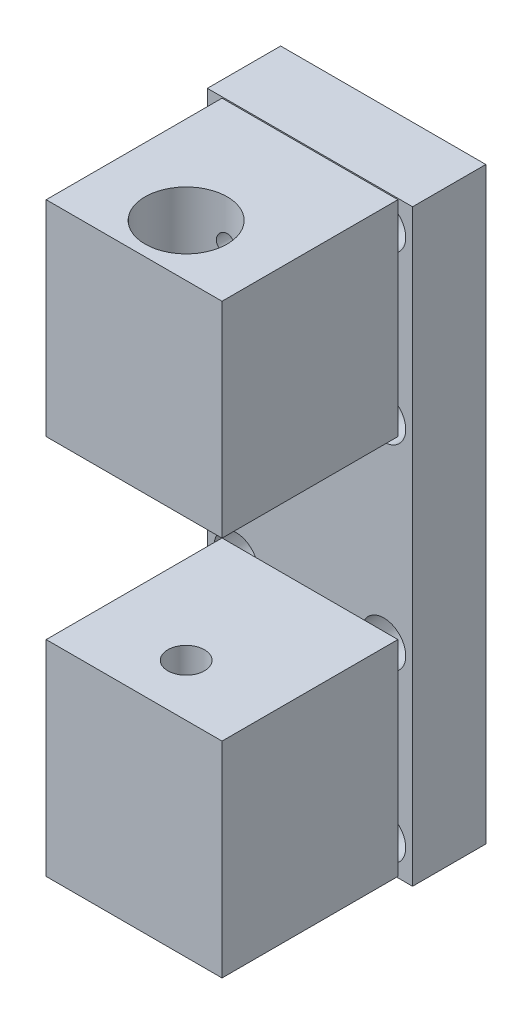
from build123d import *

# Parameters (mm, degrees)
SKETCH1_W               = 44.45
SKETCH1_H               = 127.5
SKETCH1_R               = 2.65
BOSS_EXTRUDE1_DEPTH     = 6.35
BOSS_EXTRUDE2_START     = 6.35
SKETCH1_3_W             = 44.45
SKETCH1_3_H             = 127.5
SKETCH1_3_R             = 4.75
BOSS_EXTRUDE2_DEPTH     = 9.525
SKETCH3_W               = 38.1
SKETCH3_H               = 44.45
BOSS_EXTRUDE3_DEPTH     = 19.05
SKETCH4_R               = 3.96875
CUT_EXTRUDE1_DEPTH      = 218.433121666
CUT_EXTRUDE2_START      = -5.55625
SKETCH4_3_R             = 8.89
CUT_EXTRUDE2_DEPTH      = 212.876871666
CUT_EXTRUDE3_REACH      = 227.903
CUT_EXTRUDE3_END_RADIUS = 8.89
SKETCH5_R               = 2.1
SKETCH5_3_R             = 2.65
SKETCH5_3_R_2           = 2.1
CUT_EXTRUDE4_DEPTH      = 226.903311729
SKETCH5_4_R             = 4.75
SKETCH5_4_R_2           = 2.65
CUT_EXTRUDE5_DEPTH      = 6.35
MIRROR2_OUTLINE_R       = 4.75
MIRROR2_DEPTH           = 6.35
MIRROR2_START           = 6.35
MIRROR2_2_OUTLINE_R     = 2.65
MIRROR2_2_DEPTH         = 9.525


# Read off the part's stored shape, not the designer's step: Mirror2
with BuildPart() as part:
    # Sketch1 → Boss-Extrude1 (new body)
    with BuildSketch(Plane.XY):
        with Locations((-171.45, -39.25)):
            Rectangle(SKETCH1_W, SKETCH1_H)
        with Locations((-155.45, -96.5)):
            Circle(SKETCH1_R, mode=Mode.SUBTRACT)
        with Locations((-187.45, -96.5)):
            Circle(SKETCH1_R, mode=Mode.SUBTRACT)
        with Locations((-187.45, -60.5)):
            Circle(SKETCH1_R, mode=Mode.SUBTRACT)
        with Locations((-155.45, -60.5)):
            Circle(SKETCH1_R, mode=Mode.SUBTRACT)
        with Locations((-155.45, -18)):
            Circle(SKETCH1_R, mode=Mode.SUBTRACT)
        with Locations((-187.45, -18)):
            Circle(SKETCH1_R, mode=Mode.SUBTRACT)
        with Locations((-187.45, 18)):
            Circle(SKETCH1_R, mode=Mode.SUBTRACT)
        with Locations((-155.45, 18)):
            Circle(SKETCH1_R, mode=Mode.SUBTRACT)
    extrude(amount=BOSS_EXTRUDE1_DEPTH)

    # Sketch1<3> → Boss-Extrude2 (add)
    with BuildSketch(Plane.XY.offset(BOSS_EXTRUDE2_START)):
        with Locations((-171.45, -39.25)):
            Rectangle(SKETCH1_3_W, SKETCH1_3_H)
        with Locations(Location((-187.45, -96.5, 0), (0, 0, 180))):
            Circle(SKETCH1_3_R, mode=Mode.SUBTRACT)
        with Locations(Location((-155.45, -96.5, 0), (0, 0, 180))):
            Circle(SKETCH1_3_R, mode=Mode.SUBTRACT)
        with Locations(Location((-187.45, -60.5, 0), (0, 0, 180))):
            Circle(SKETCH1_3_R, mode=Mode.SUBTRACT)
        with Locations(Location((-155.45, -60.5, 0), (0, 0, 180))):
            Circle(SKETCH1_3_R, mode=Mode.SUBTRACT)
        with Locations(Location((-155.45, -18, 0), (0, 0, 180))):
            Circle(SKETCH1_3_R, mode=Mode.SUBTRACT)
        with Locations(Location((-187.45, -18, 0), (0, 0, 180))):
            Circle(SKETCH1_3_R, mode=Mode.SUBTRACT)
        with Locations(Location((-187.45, 18, 0), (0, 0, 180))):
            Circle(SKETCH1_3_R, mode=Mode.SUBTRACT)
        with Locations(Location((-155.45, 18, 0), (0, 0, 180))):
            Circle(SKETCH1_3_R, mode=Mode.SUBTRACT)
    extrude(amount=BOSS_EXTRUDE2_DEPTH)


with BuildPart() as body_2:
    # Sketch3 → Boss-Extrude3 (new, symmetric)
    with BuildSketch(Plane.ZY.offset(171.45)):
        with Locations((34.925, -80.513019347)):
            Rectangle(SKETCH3_W, SKETCH3_H)
    extrude(amount=BOSS_EXTRUDE3_DEPTH, both=True)

    # Sketch4 → Cut-Extrude1 (cut, through all)
    with BuildSketch(Plane(origin=(0, -58.288019347, 0), x_dir=(-1, 0, 0), z_dir=(0, 1, 0))):
        with Locations(Location((171.45, 42.70375, 0), (0, 0, 90))):
            Circle(SKETCH4_R)
    extrude(amount=-CUT_EXTRUDE1_DEPTH, mode=Mode.SUBTRACT)

    # Sketch4<3> → Cut-Extrude2 (cut, through all)
    with BuildSketch(Plane(origin=(0, -58.288019347, 0), x_dir=(-1, 0, 0), z_dir=(0, 1, 0)).offset(CUT_EXTRUDE2_START)):
        with Locations(Location((171.45, 42.70375, 0), (0, 0, 90))):
            Circle(SKETCH4_3_R)
    extrude(amount=-CUT_EXTRUDE2_DEPTH, mode=Mode.SUBTRACT)


with BuildPart() as cut_extrude3_tool:
    # Cut-Extrude3: up to this cylinder (the profile starts outside it)
    cut_extrude3_end = Plane(origin=(-171.45, -80.741619, 42.70375), z_dir=(0, 1, 0)) * Cylinder(CUT_EXTRUDE3_END_RADIUS, 500.5788, mode=Mode.PRIVATE)
    # Sketch5 → Cut-Extrude3 (new, up to the surface)
    with BuildSketch(Plane(origin=(0, 0, 0), x_dir=(1, 0, 0), z_dir=(0, 0, -1)), mode=Mode.PRIVATE) as cut_extrude3_sk1:
        with Locations(Location((-171.45, 67.745219347, 0), (0, 0, 180))):
            Circle(SKETCH5_R)
    cut_extrude3_tool1 = extrude(cut_extrude3_sk1.sketch, amount=-CUT_EXTRUDE3_REACH, mode=Mode.PRIVATE) - cut_extrude3_end
    add(cut_extrude3_tool1.solids().sort_by_distance((-171.45, -67.745219, 0))[0])
    # Sketch5 → Cut-Extrude3 (new, up to the surface)
    with BuildSketch(Plane(origin=(0, 0, 0), x_dir=(1, 0, 0), z_dir=(0, 0, -1)), mode=Mode.PRIVATE) as cut_extrude3_sk2:
        with Locations(Location((-171.45, 93.738019347, 0), (0, 0, 180))):
            Circle(SKETCH5_R)
    cut_extrude3_tool2 = extrude(cut_extrude3_sk2.sketch, amount=-CUT_EXTRUDE3_REACH, mode=Mode.PRIVATE) - cut_extrude3_end
    add(cut_extrude3_tool2.solids().sort_by_distance((-171.45, -93.738019, 0))[0])


with BuildPart() as part_1:
    add(part.part)

    # Cut-Extrude3: cut by cut_extrude3_tool
    add(cut_extrude3_tool.part, mode=Mode.SUBTRACT)

    # Sketch5<3> → Cut-Extrude4 (cut, through all)
    # profile 1 of 2: a face of its own
    with BuildSketch(Plane(origin=(0, 0, 0), x_dir=(1, 0, 0), z_dir=(0, 0, -1))):
        with Locations(Location((-171.45, 67.745219347, 0), (0, 0, 180))):
            Circle(SKETCH5_3_R)
        with Locations(Location((-171.45, 67.745219347, 0), (0, 0, 180))):
            Circle(SKETCH5_3_R_2, mode=Mode.SUBTRACT)
    # profile 2 of 2: a face of its own
    with BuildSketch(Plane(origin=(0, 0, 0), x_dir=(1, 0, 0), z_dir=(0, 0, -1))):
        with Locations(Location((-171.45, 93.738019347, 0), (0, 0, 180))):
            Circle(SKETCH5_3_R)
        with Locations(Location((-171.45, 93.738019347, 0), (0, 0, 180))):
            Circle(SKETCH5_3_R_2, mode=Mode.SUBTRACT)
    extrude(amount=-CUT_EXTRUDE4_DEPTH, mode=Mode.SUBTRACT)

    # Sketch5<4> → Cut-Extrude5 (cut)
    # profile 1 of 2: a face of its own
    with BuildSketch(Plane(origin=(0, 0, 0), x_dir=(1, 0, 0), z_dir=(0, 0, -1))):
        with Locations(Location((-171.45, 67.745219347, 0), (0, 0, 180))):
            Circle(SKETCH5_4_R)
        with Locations(Location((-171.45, 67.745219347, 0), (0, 0, 180))):
            Circle(SKETCH5_4_R_2, mode=Mode.SUBTRACT)
    # profile 2 of 2: a face of its own
    with BuildSketch(Plane(origin=(0, 0, 0), x_dir=(1, 0, 0), z_dir=(0, 0, -1))):
        with Locations(Location((-171.45, 93.738019347, 0), (0, 0, 180))):
            Circle(SKETCH5_4_R)
        with Locations(Location((-171.45, 93.738019347, 0), (0, 0, 180))):
            Circle(SKETCH5_4_R_2, mode=Mode.SUBTRACT)
    extrude(amount=-CUT_EXTRUDE5_DEPTH, mode=Mode.SUBTRACT)

    # Mirror2 outline → Mirror2 (cut)
    with BuildSketch(Plane.XY):
        with Locations((-171.45, 15.238019347)):
            Circle(MIRROR2_OUTLINE_R)
        with Locations((-171.45, -10.754780653)):
            Circle(MIRROR2_OUTLINE_R)
    extrude(amount=MIRROR2_DEPTH, mode=Mode.SUBTRACT)

    # Mirror2 2 outline → Mirror2 2 (cut)
    with BuildSketch(Plane.XY.offset(MIRROR2_START)):
        with Locations((-171.45, 15.238019347)):
            Circle(MIRROR2_2_OUTLINE_R)
        with Locations((-171.45, -10.754780653)):
            Circle(MIRROR2_2_OUTLINE_R)
    extrude(amount=MIRROR2_2_DEPTH, mode=Mode.SUBTRACT)


with BuildPart() as body_2_1:
    add(body_2.part)

    # Cut-Extrude3: cut by cut_extrude3_tool
    add(cut_extrude3_tool.part, mode=Mode.SUBTRACT)


with BuildPart() as body_3:
    # Mirror1: mirrored copy
    add(body_2_1.part.mirror(Plane.ZX.offset(-39.25)))


solid = Compound([part_1.part, body_2_1.part, body_3.part])
